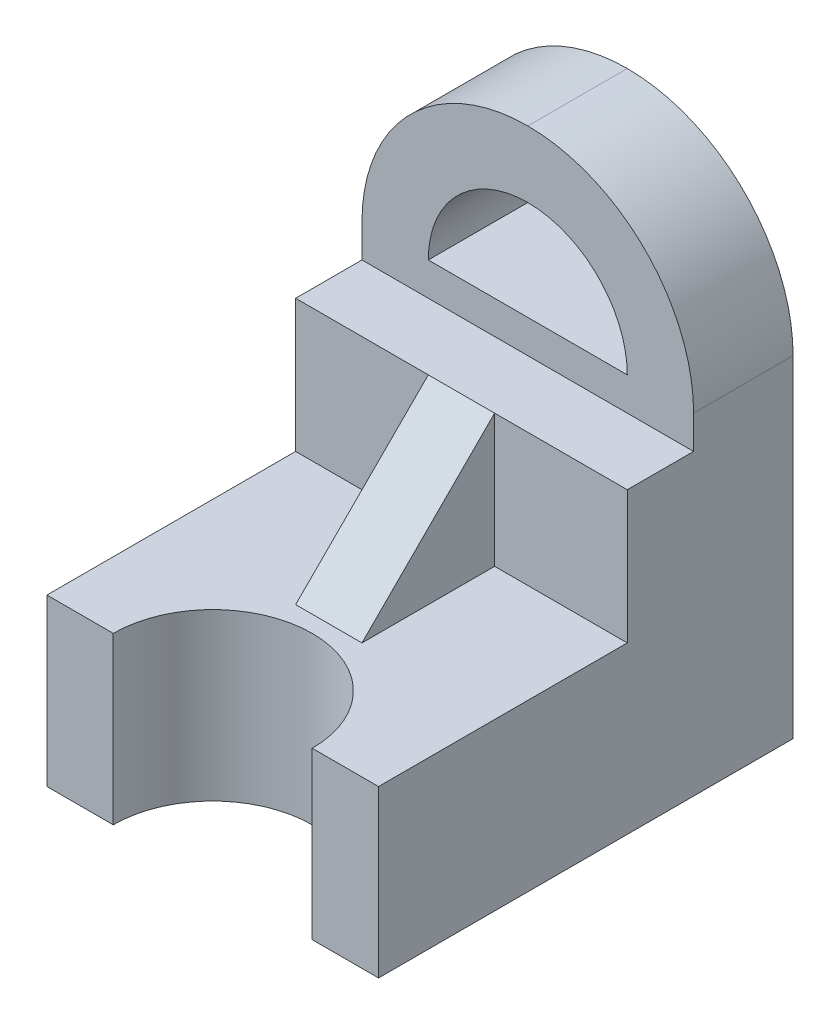
from build123d import *

# Parameters (mm, degrees)
BOSS_EXTRUDE1_DEPTH = 50
SKETCH2_W           = 100
SKETCH2_H           = 50
BOSS_EXTRUDE2_DEPTH = 90
SKETCH3_W           = 100
SKETCH3_H           = 30
BOSS_EXTRUDE3_DEPTH = 150
BOSS_EXTRUDE4_DEPTH = 10
FILLET1_R           = 50
CUT_EXTRUDE1_DEPTH  = 171.018381359


with BuildPart() as part:
    # Sketch1 → Boss-Extrude1 (new body)
    with BuildSketch(Plane(origin=(0, 0, 0), x_dir=(1, 0, 0), z_dir=(0, 1, 0))):
        with BuildLine():
            Line((30, -62.5), (50, -62.5))
            Line((50, -62.5), (50, 62.5))
            Line((50, 62.5), (-50, 62.5))
            Line((-50, 62.5), (-50, -62.5))
            Line((-50, -62.5), (-30, -62.5))
            ThreePointArc((-30, -62.5), (0, -32.5), (30, -62.5))
        make_face()
    extrude(amount=BOSS_EXTRUDE1_DEPTH)

    # Sketch2 → Boss-Extrude2 (add)
    with BuildSketch(Plane(origin=(0, 0, 0), x_dir=(1, 0, 0), z_dir=(0, 1, 0))):
        with Locations((0, 37.5)):
            Rectangle(SKETCH2_W, SKETCH2_H)
    extrude(amount=BOSS_EXTRUDE2_DEPTH)

    # Sketch3 → Boss-Extrude3 (add)
    with BuildSketch(Plane(origin=(0, 0, 0), x_dir=(1, 0, 0), z_dir=(0, 1, 0))):
        with Locations((0, 47.5)):
            Rectangle(SKETCH3_W, SKETCH3_H)
    extrude(amount=BOSS_EXTRUDE3_DEPTH)

    # Sketch4 → Boss-Extrude4 (add, symmetric)
    with BuildSketch(Plane(origin=(0, 0, 0), x_dir=(0, 0, -1), z_dir=(1, 0, 0))):
        Polygon((12.5, 90), (-27.5, 50), (12.5, 50), align=None)
    extrude(amount=BOSS_EXTRUDE4_DEPTH, both=True)

    # Fillet1
    fillet1_edges = [part.edges().sort_by_distance(p)[0] for p in [
        (-50, 150, -47.5),
        (50, 150, -47.5),
    ]]
    fillet(fillet1_edges, radius=FILLET1_R - 0.0001)  # a hair under: the kernel refuses the full size

    # Sketch6 → Cut-Extrude1 (cut, through all)
    with BuildSketch(Plane.XY):
        with BuildLine():
            Line((-30, 100), (30, 100))
            ThreePointArc((30, 100), (0, 130), (-30, 100))
        make_face()
    extrude(amount=-CUT_EXTRUDE1_DEPTH, mode=Mode.SUBTRACT)


solid = part.part
